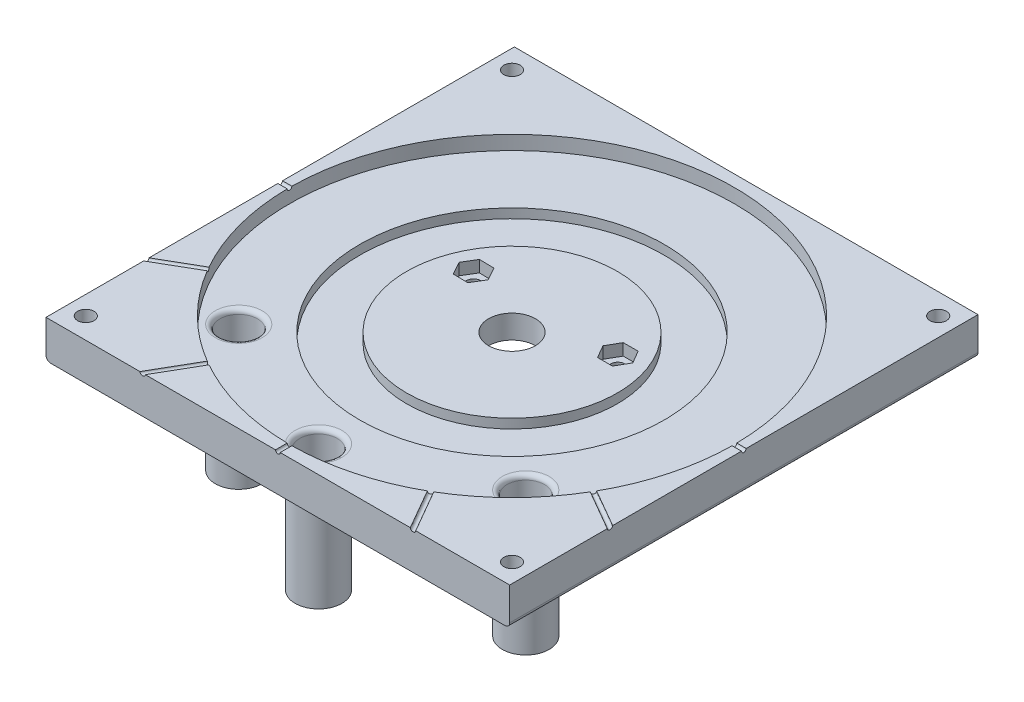
from build123d import *

# Parameters (mm, degrees)
SKETCH1_W           = 99
SKETCH1_H           = 100
BOSS_EXTRUDE1_DEPTH = 8
SKETCH2_R           = 47.5
CUT_EXTRUDE1_DEPTH  = 3
SKETCH3_R           = 4
CUT_EXTRUDE2_DEPTH  = 71.811369144
SKETCH7_R           = 32.5
SKETCH7_R_2         = 22.5
CUT_EXTRUDE3_DEPTH  = 2
SKETCH8_R           = 5
CUT_EXTRUDE4_DEPTH  = 71.811369144
SKETCH10_R          = 1.5
CUT_EXTRUDE6_DEPTH  = 71.811369144
CUT_EXTRUDE7_DEPTH  = 2.5
BOSS_EXTRUDE2_START = 22
SKETCH14_R          = 5
SKETCH14_R_2        = 4
BOSS_EXTRUDE2_DEPTH = 22
SKETCH15_R          = 1.75
CUT_EXTRUDE8_DEPTH  = 77.486926988
FILLET3_R           = 1.5
FILLET4_R           = 1
FILLET6_R           = 1
CUT_SWEEP2_START    = -49.5
CUT_SWEEP2_DEPTH    = 2.002631778
CIRPATTERN4_START   = 47.497368222
CIRPATTERN4_DEPTH   = 2.002631778
CIRPATTERN4_START_2 = -57.446351884
CIRPATTERN4_2_DEPTH = 9.948983662
CIRPATTERN4_START_3 = -58.023702154
CIRPATTERN4_3_DEPTH = 10.526333932
CIRPATTERN4_4_DEPTH = 2.502631778
CIRPATTERN4_5_DEPTH = 10.526333932
CIRPATTERN4_6_DEPTH = 9.948983662


# Read off the part's stored shape, not the designer's step: Cut-Sweep2, CirPattern4
with BuildPart() as part:
    # Sketch1 → Boss-Extrude1 (new body)
    with BuildSketch(Plane(origin=(0, 0, 0), x_dir=(1, 0, 0), z_dir=(0, 1, 0))):
        Rectangle(SKETCH1_W, SKETCH1_H)
    extrude(amount=BOSS_EXTRUDE1_DEPTH)

    # Sketch2 → Cut-Extrude1 (cut)
    with BuildSketch(Plane(origin=(0, 8, 0), x_dir=(1, 0, 0), z_dir=(0, 1, 0))):
        with Locations(Location((0, 0, 0), (0, 0, 270))):
            Circle(SKETCH2_R)
    extrude(amount=-CUT_EXTRUDE1_DEPTH, mode=Mode.SUBTRACT)

    # Sketch3 → Cut-Extrude2 (cut, through all)
    with BuildSketch(Plane.XZ):
        with Locations(Location((0, 41.31, 0), (0, 0, 270))):
            Circle(SKETCH3_R)
        with Locations(Location((-30.641642767, 27.70570029, 0), (0, 0, 270))):
            Circle(SKETCH3_R)
        with Locations(Location((30.641642767, 27.70570029, 0), (0, 0, 270))):
            Circle(SKETCH3_R)
    extrude(amount=-CUT_EXTRUDE2_DEPTH, mode=Mode.SUBTRACT)

    # Sketch7 → Cut-Extrude3 (cut)
    with BuildSketch(Plane(origin=(0, 5, 0), x_dir=(1, 0, 0), z_dir=(0, 1, 0))):
        with Locations(Location((0, 0, 0), (0, 0, 270))):
            Circle(SKETCH7_R)
        with Locations(Location((0, 0, 0), (0, 0, 270))):
            Circle(SKETCH7_R_2, mode=Mode.SUBTRACT)
    extrude(amount=-CUT_EXTRUDE3_DEPTH, mode=Mode.SUBTRACT)

    # Sketch8 → Cut-Extrude4 (cut, through all)
    with BuildSketch(Plane.XZ):
        with Locations(Location((0, 0, 0), (0, 0, 270))):
            Circle(SKETCH8_R)
    extrude(amount=-CUT_EXTRUDE4_DEPTH, mode=Mode.SUBTRACT)

    # Sketch10 → Cut-Extrude6 (cut, through all)
    with BuildSketch(Plane.XZ):
        with Locations(Location((-15.4, -7.2, 0), (0, 0, 270))):
            Circle(SKETCH10_R)
        with Locations(Location((15.4, -7.2, 0), (0, 0, 270))):
            Circle(SKETCH10_R)
    extrude(amount=-CUT_EXTRUDE6_DEPTH, mode=Mode.SUBTRACT)

    # Sketch13 → Cut-Extrude7 (cut)
    with BuildSketch(Plane(origin=(0, 5, 0), x_dir=(1, 0, 0), z_dir=(0, 1, 0))):
        Polygon((-13.86343559, 4.421096773), (-12.225117005, 7.1412522), (-13.761681416, 9.920155427), (-16.93656441, 9.978903227), (-18.574882995, 7.2587478), (-17.038318584, 4.479844573), align=None)
        Polygon((16.994802314, 4.45410508), (18.575415914, 7.208191857), (16.9806136, 9.954086778), (13.805197686, 9.94589492), (12.224584086, 7.191808143), (13.8193864, 4.445913222), align=None)
    extrude(amount=-CUT_EXTRUDE7_DEPTH, mode=Mode.SUBTRACT)

    # Sketch14 → Boss-Extrude2 (add)
    # profile 1 of 3: a face of its own
    with BuildSketch(Plane.XZ.offset(BOSS_EXTRUDE2_START)):
        with Locations(Location((0, 41.31, 0), (0, 0, 270))):
            Circle(SKETCH14_R)
        with Locations(Location((0, 41.31, 0), (0, 0, 270))):
            Circle(SKETCH14_R_2, mode=Mode.SUBTRACT)
    # profile 2 of 3: a face of its own
    with BuildSketch(Plane.XZ.offset(BOSS_EXTRUDE2_START)):
        with Locations(Location((-30.641642767, 27.70570029, 0), (0, 0, 270))):
            Circle(SKETCH14_R)
        with Locations(Location((-30.641642767, 27.70570029, 0), (0, 0, 270))):
            Circle(SKETCH14_R_2, mode=Mode.SUBTRACT)
    # profile 3 of 3: a face of its own
    with BuildSketch(Plane.XZ.offset(BOSS_EXTRUDE2_START)):
        with Locations(Location((30.641642767, 27.70570029, 0), (0, 0, 270))):
            Circle(SKETCH14_R)
        with Locations(Location((30.641642767, 27.70570029, 0), (0, 0, 270))):
            Circle(SKETCH14_R_2, mode=Mode.SUBTRACT)
    extrude(amount=-BOSS_EXTRUDE2_DEPTH)

    # Sketch15 → Cut-Extrude8 (cut, through all)
    with BuildSketch(Plane(origin=(0, 8, 0), x_dir=(1, 0, 0), z_dir=(0, 1, 0))):
        with Locations(Location((-45.5, -45.5, 0), (0, 0, 270))):
            Circle(SKETCH15_R)
        with Locations(Location((45.5, -45.5, 0), (0, 0, 90))):
            Circle(SKETCH15_R)
        with Locations(Location((45.5, 45.5, 0), (0, 0, 270))):
            Circle(SKETCH15_R)
        with Locations(Location((-45.5, 45.5, 0), (0, 0, 90))):
            Circle(SKETCH15_R)
    extrude(amount=-CUT_EXTRUDE8_DEPTH, mode=Mode.SUBTRACT)

    # Fillet3
    fillet3_edges = [part.edges().sort_by_distance(p)[0] for p in [
        (0, 0, 46.31),
        (-30.641642767, 0, 32.70570029),
        (30.641642767, 0, 32.70570029),
    ]]
    fillet(fillet3_edges, radius=FILLET3_R)

    # Fillet4
    fillet4_edges = [part.edges().sort_by_distance(p)[0] for p in [
        (49.5, 0, 0),
        (-49.5, 0, 0),
    ]]
    fillet(fillet4_edges, radius=FILLET4_R)

    # Fillet6
    fillet6_edges = [part.edges().sort_by_distance(p)[0] for p in [
        (0, 5, 45.31),
        (-30.641642767, 5, 31.70570029),
        (30.641642767, 5, 31.70570029),
    ]]
    fillet(fillet6_edges, radius=FILLET6_R)

    # Cut-Sweep2 outline → Cut-Sweep2 (cut)
    with BuildSketch(Plane.YZ.offset(CUT_SWEEP2_START)):
        with BuildLine():
            Line((8, -0.5), (8, 0.5))
            ThreePointArc((8, 0.5), (7.5, 0), (8, -0.5))
        make_face()
    extrude(amount=CUT_SWEEP2_DEPTH, mode=Mode.SUBTRACT)

    # CirPattern4 outline → CirPattern4 (cut)
    with BuildSketch(Plane.YZ.offset(CIRPATTERN4_START)):
        with BuildLine():
            ThreePointArc((8, 0.5), (7.5, 0), (8, -0.5))
            Line((8, -0.5), (8, 0.5))
        make_face()
    extrude(amount=CIRPATTERN4_DEPTH, mode=Mode.SUBTRACT)

    # CirPattern4 2 outline → CirPattern4 2 (cut)
    with BuildSketch(Plane(origin=(0, 0, 0), x_dir=(0.5000000000000016, 0, 0.8660254037844377), z_dir=(0.8660254037844377, 0, -0.5000000000000018)).offset(CIRPATTERN4_START_2)):
        with BuildLine():
            Line((-0.5, -8), (0.5, -8))
            ThreePointArc((0.5, -8), (0, -7.5), (-0.5, -8))
        make_face()
    extrude(amount=CIRPATTERN4_2_DEPTH, mode=Mode.SUBTRACT)

    # CirPattern4 3 outline → CirPattern4 3 (cut)
    with BuildSketch(Plane(origin=(0, 0, 0), x_dir=(0.8660254037844403, 0, 0.49999999999999717), z_dir=(0.49999999999999717, 0, -0.8660254037844404)).offset(CIRPATTERN4_START_3)):
        with BuildLine():
            Line((-0.5, -8), (0.5, -8))
            ThreePointArc((0.5, -8), (0, -7.5), (-0.5, -8))
        make_face()
    extrude(amount=CIRPATTERN4_3_DEPTH, mode=Mode.SUBTRACT)

    # CirPattern4 4 outline → CirPattern4 4 (cut)
    with BuildSketch(Plane.XY.offset(CIRPATTERN4_START)):
        with BuildLine():
            ThreePointArc((-0.5, 8), (0, 7.5), (0.5, 8))
            Line((0.5, 8), (-0.5, 8))
        make_face()
    extrude(amount=CIRPATTERN4_4_DEPTH, mode=Mode.SUBTRACT)

    # CirPattern4 5 outline → CirPattern4 5 (cut)
    with BuildSketch(Plane(origin=(0, 0, 0), x_dir=(0.8660254037844362, 0, -0.5000000000000042), z_dir=(0.5000000000000042, 0, 0.8660254037844363)).offset(CIRPATTERN4_START)):
        with BuildLine():
            ThreePointArc((-0.5, 8), (0, 7.5), (0.5, 8))
            Line((0.5, 8), (-0.5, 8))
        make_face()
    extrude(amount=CIRPATTERN4_5_DEPTH, mode=Mode.SUBTRACT)

    # CirPattern4 6 outline → CirPattern4 6 (cut)
    with BuildSketch(Plane(origin=(0, 0, 0), x_dir=(0.4999999999999938, 0, -0.8660254037844423), z_dir=(0.8660254037844421, 0, 0.49999999999999406)).offset(CIRPATTERN4_START)):
        with BuildLine():
            ThreePointArc((-0.5, 8), (0, 7.5), (0.5, 8))
            Line((0.5, 8), (-0.5, 8))
        make_face()
    extrude(amount=CIRPATTERN4_6_DEPTH, mode=Mode.SUBTRACT)


solid = part.part
